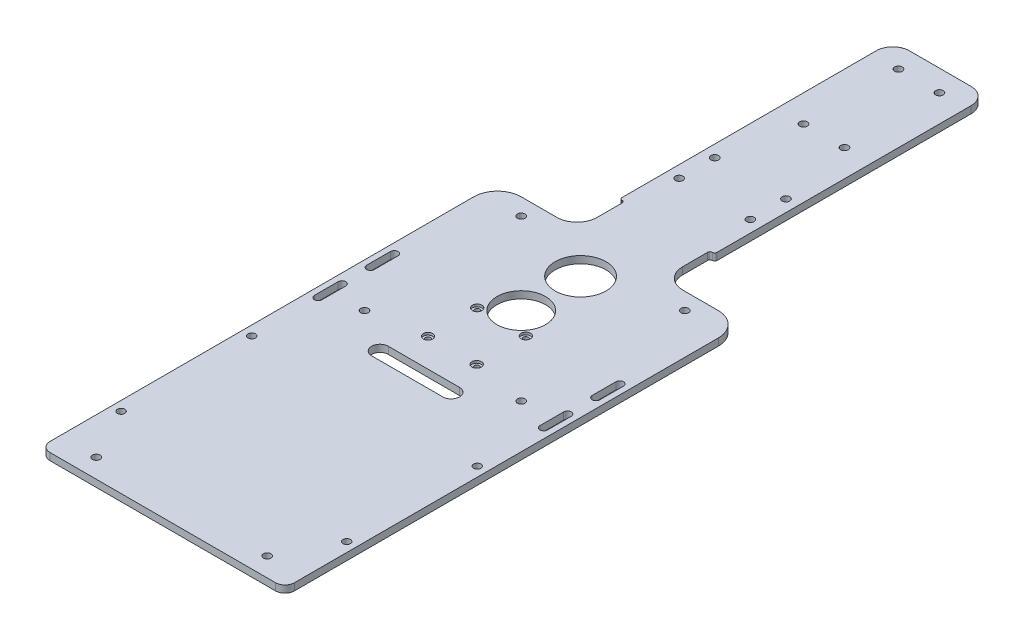
from build123d import *

# Parameters (mm, degrees)
SKETCH_1_W                = 200
SKETCH_1_H                = 200
EXTRUDE_1_DEPTH           = 3
SKETCH_2_R                = 1.5
CUT_EXTRUDE_2_DEPTH       = 10
CUT_EXTRUDE_3_DEPTH       = 10
SKETCH_6_R                = 1.6
CUT_EXTRUDE_3_1_1_DEPTH   = 10
CUT_EXTRUDE_6_REACH       = 111.495
SKETCH_11_R               = 1.5
CUT_EXTRUDE_21_4_REACH    = 111.495
SKETCH_4_R                = 10.7
FILLET_1_R                = 1
SKETCH_12_W               = 40
SKETCH_12_H               = 3
EXTRUDE_2_DEPTH           = 75
FILLET_2_R                = 7
SKETCH_13_R               = 1.6
CUT_EXTRUDE_3_2_3_DEPTH   = 10
SKETCH_19_W               = 89
SKETCH_19_H               = 3
EXTRUDE_3_DEPTH           = 105
CUT_EXTRUDE_7519_REACH    = 211.796
SKETCH_14_R               = 10.25
HOLE_WIZARD_1_D           = 2.2
HOLE_WIZARD_1_CBORE_D     = 4
HOLE_WIZARD_1_CBORE_DEPTH = 1
CUT_EXTRUDE_8_REACH       = 211.796
SKETCH_23_R               = 1.6
SKETCH_24_W               = 192.5
SKETCH_24_H               = 3
EXTRUDE_4_DEPTH           = 7
FILLET_3_R                = 10
CUT_EXTRUDE_10527_DEPTH   = 7
CUT_EXTRUDE_7_REACH       = 213.391
SKETCH_22_R               = 1.6
SKETCH_16_R               = 1.6
CUT_EXTRUDE_9_DEPTH       = 10
CUT_EXTRUDE_13046_DEPTH   = 10
HOLE_WIZARD_3_1_3_1_1_D   = 3.1
FILLET_4_R                = 4


with BuildPart() as part:
    # 草图1 → 凸台-拉伸1 (new body)
    with BuildSketch(Plane(origin=(0, 0, 0), x_dir=(1, 0, 0), z_dir=(0, 1, 0))):
        Rectangle(SKETCH_1_W, SKETCH_1_H)
    extrude(amount=EXTRUDE_1_DEPTH)

    # 草图2 → 切除-拉伸2 (cut)
    with BuildSketch(Plane(origin=(0, 3, 0), x_dir=(1, 0, 0), z_dir=(0, 1, 0))):
        with Locations(Location((29.5, 9.5, 0), (0, 0, 270))):
            Circle(SKETCH_2_R)
        with Locations(Location((21.5, 0, 0), (0, 0, 270))):
            Circle(SKETCH_2_R)
        with Locations(Location((29.5, -9.5, 0), (0, 0, 270))):
            Circle(SKETCH_2_R)
        with Locations(Location((37.5, 0, 0), (0, 0, 270))):
            Circle(SKETCH_2_R)
        with Locations(Location((-29.5, -9.5, 0), (0, 0, 270))):
            Circle(SKETCH_2_R)
        with Locations(Location((-37.5, 0, 0), (0, 0, 270))):
            Circle(SKETCH_2_R)
        with Locations(Location((-21.5, 0, 0), (0, 0, 270))):
            Circle(SKETCH_2_R)
        with Locations(Location((-29.5, 9.5, 0), (0, 0, 270))):
            Circle(SKETCH_2_R)
    extrude(amount=-CUT_EXTRUDE_2_DEPTH, mode=Mode.SUBTRACT)

    # 草图5 → 切除-拉伸3 (cut)
    with BuildSketch(Plane(origin=(0, 3, 0), x_dir=(1, 0, 0), z_dir=(0, 1, 0))):
        with BuildLine():
            Line((-100, -100), (-44.5, -100))
            Line((-44.5, -100), (-44.5, 0))
            ThreePointArc((-44.5, 0), (-40.212142643, 10.5), (-29.8, 14.9969997))
            ThreePointArc((-29.8, 14.9969997), (-22.858571571, 17.9949995), (-20, 24.9949995))
            Line((-20, 24.9949995), (-20, 47.5))
            Line((-20, 47.5), (0, 47.5))
            Line((0, 47.5), (20, 47.5))
            Line((20, 47.5), (20, 24.9949995))
            ThreePointArc((20, 24.9949995), (22.858571571, 17.9949995), (29.8, 14.9969997))
            ThreePointArc((29.8, 14.9969997), (40.212142643, 10.5), (44.5, 0))
            Line((44.5, 0), (44.5, -100))
            Line((44.5, -100), (100, -100))
            Line((100, -100), (100, 100))
            Line((100, 100), (-100, 100))
            Line((-100, 100), (-100, -100))
        make_face()
    extrude(amount=-CUT_EXTRUDE_3_DEPTH, mode=Mode.SUBTRACT)

    # 草图6 → φ3.1通孔1 (cut)
    with BuildSketch(Plane.XZ):
        with Locations(Location((-15, -42.5, 0), (0, 0, 270))):
            Circle(SKETCH_6_R)
        with Locations(Location((-15, -27.5, 0), (0, 0, 270))):
            Circle(SKETCH_6_R)
        with Locations(Location((15, -27.5, 0), (0, 0, 90))):
            Circle(SKETCH_6_R)
        with Locations(Location((15, -42.5, 0), (0, 0, 90))):
            Circle(SKETCH_6_R)
    extrude(amount=-CUT_EXTRUDE_3_1_1_DEPTH, mode=Mode.SUBTRACT)

    # 草图11 → 切除-拉伸6 (cut, up to next)
    with BuildSketch(Plane(origin=(0, 3, 0), x_dir=(1, 0, 0), z_dir=(0, 1, 0)), mode=Mode.PRIVATE) as cut_extrude_6_sk1:
        with BuildLine():
            Line((44.5, -17.5), (44.5, -100))
            Line((44.5, -100), (101.133062566, -100))
            Line((101.133062566, -100), (101.133062566, 47.5))
            Line((101.133062566, 47.5), (20, 47.5))
            Line((20, 47.5), (20, 7.5))
            Line((20, 7.5), (19, 7.5))
            ThreePointArc((19, 7.5), (18.292893219, 7.207106781), (18, 6.5))
            Line((18, 6.5), (18, -4))
            ThreePointArc((18, -4), (20.48959236, -10.01040764), (26.5, -12.5))
            Line((26.5, -12.5), (39.5, -12.5))
            Line((39.5, -12.5), (44.5, -12.5))
            Line((44.5, -12.5), (44.5, -17.5))
        make_face()
        with Locations((29.5, -9.5)):
            Circle(SKETCH_11_R, mode=Mode.SUBTRACT)
        with Locations((21.5, 0)):
            Circle(SKETCH_11_R, mode=Mode.SUBTRACT)
    cut_extrude_6_tool1 = extrude(cut_extrude_6_sk1.sketch, amount=-CUT_EXTRUDE_6_REACH, mode=Mode.PRIVATE) & part.part
    # 草图11 → 切除-拉伸6 (cut, up to next)
    with BuildSketch(Plane(origin=(0, 3, 0), x_dir=(1, 0, 0), z_dir=(0, 1, 0)), mode=Mode.PRIVATE) as cut_extrude_6_sk2:
        with BuildLine():
            Line((-44.5, -17.5), (-44.5, -100))
            Line((-44.5, -100), (-101.133062566, -100))
            Line((-101.133062566, -100), (-101.133062566, 47.5))
            Line((-101.133062566, 47.5), (-20, 47.5))
            Line((-20, 47.5), (-20, 7.5))
            Line((-20, 7.5), (-19, 7.5))
            ThreePointArc((-19, 7.5), (-18.292893219, 7.207106781), (-18, 6.5))
            Line((-18, 6.5), (-18, -4))
            ThreePointArc((-18, -4), (-20.48959236, -10.01040764), (-26.5, -12.5))
            Line((-26.5, -12.5), (-39.5, -12.5))
            Line((-39.5, -12.5), (-44.5, -12.5))
            Line((-44.5, -12.5), (-44.5, -17.5))
        make_face()
    cut_extrude_6_tool2 = extrude(cut_extrude_6_sk2.sketch, amount=-CUT_EXTRUDE_6_REACH, mode=Mode.PRIVATE) & part.part
    add(cut_extrude_6_tool1.solids().sort_by_distance((66.686037, 3, 19.669577))[0], mode=Mode.SUBTRACT)
    add(cut_extrude_6_tool2.solids().sort_by_distance((-66.626911, 3, 19.648158))[0], mode=Mode.SUBTRACT)

    # 草图4 → φ21.4落弹孔 (cut, up to next)
    with BuildSketch(Plane(origin=(0, 3, 0), x_dir=(1, 0, 0), z_dir=(0, 1, 0)), mode=Mode.PRIVATE) as cut_extrude_21_4_sk1:
        with Locations(Location((0, -29, 0), (0, 0, 270))):
            Circle(SKETCH_4_R)
    cut_extrude_21_4_tool1 = extrude(cut_extrude_21_4_sk1.sketch, amount=-CUT_EXTRUDE_21_4_REACH, mode=Mode.PRIVATE) & part.part
    add(cut_extrude_21_4_tool1.solids().sort_by_distance((0, 3, 29))[0], mode=Mode.SUBTRACT)

    # 圆角1
    fillet_1_edges = [part.edges().sort_by_distance(p)[0] for p in [
        (-20, 1.5, -7.5),
        (20, 1.5, -7.5),
    ]]
    fillet(fillet_1_edges, radius=FILLET_1_R - 0.0001)  # a hair under: the kernel refuses the full size

    # 草图12 → 凸台-拉伸2 (add)
    with BuildSketch(Plane(origin=(0, 0, -47.5), x_dir=(-1, 0, 0), z_dir=(0, 0, -1))):
        with Locations((0, 1.5)):
            Rectangle(SKETCH_12_W, SKETCH_12_H)
    extrude(amount=EXTRUDE_2_DEPTH)

    # 圆角2
    fillet_2_edges = [part.edges().sort_by_distance(p)[0] for p in [
        (20, 1.5, -122.5),
        (-20, 1.5, -122.5),
    ]]
    fillet(fillet_2_edges, radius=FILLET_2_R)

    # 草图13 → φ3.2通孔3 (cut)
    with BuildSketch(Plane(origin=(0, 3, 0), x_dir=(1, 0, 0), z_dir=(0, 1, 0))):
        with Locations(Location((-8.625, 113.5, 0), (0, 0, 270))):
            Circle(SKETCH_13_R)
        with Locations(Location((8.625, 113.5, 0), (0, 0, 270))):
            Circle(SKETCH_13_R)
        with Locations(Location((8.625, 73.5, 0), (0, 0, 270))):
            Circle(SKETCH_13_R)
        with Locations(Location((-8.625, 73.5, 0), (0, 0, 270))):
            Circle(SKETCH_13_R)
    extrude(amount=-CUT_EXTRUDE_3_2_3_DEPTH, mode=Mode.SUBTRACT)

    # 草图19 → 凸台-拉伸3 (add)
    with BuildSketch(Plane.XY.offset(100)):
        with Locations((0, 1.5)):
            Rectangle(SKETCH_19_W, SKETCH_19_H)
    extrude(amount=EXTRUDE_3_DEPTH)

    # 草图14 → Cut-Extrude 7519 (cut, up to next)
    with BuildSketch(Plane(origin=(0, 3, 0), x_dir=(1, 0, 0), z_dir=(0, 1, 0)), mode=Mode.PRIVATE) as cut_extrude_7519_sk1:
        with Locations(Location((0, -54, 0), (0, 0, 270))):
            Circle(SKETCH_14_R)
    cut_extrude_7519_tool1 = extrude(cut_extrude_7519_sk1.sketch, amount=-CUT_EXTRUDE_7519_REACH, mode=Mode.PRIVATE) & part.part
    add(cut_extrude_7519_tool1.solids().sort_by_distance((0, 3, 54))[0], mode=Mode.SUBTRACT)

    # 孔1 (through all)
    with Locations(Plane(origin=(-10.25, 3, 62.3), x_dir=(0, 0, 1), z_dir=(0, 1, 0))):
        with Locations((0, 0), (0, 20.5), (20.7, 0), (20.7, 20.5)):
            CounterBoreHole(HOLE_WIZARD_1_D / 2, HOLE_WIZARD_1_CBORE_D / 2, HOLE_WIZARD_1_CBORE_DEPTH)

    # 草图23 → 切除-拉伸8 (cut, up to next)
    with BuildSketch(Plane(origin=(0, 3, 0), x_dir=(1, 0, 0), z_dir=(0, 1, 0)), mode=Mode.PRIVATE) as cut_extrude_8_sk1:
        with Locations(Location((33, -87, 0), (0, 0, 270))):
            Circle(SKETCH_23_R)
    cut_extrude_8_tool1 = extrude(cut_extrude_8_sk1.sketch, amount=-CUT_EXTRUDE_8_REACH, mode=Mode.PRIVATE) & part.part
    # 草图23 → 切除-拉伸8 (cut, up to next)
    with BuildSketch(Plane(origin=(0, 3, 0), x_dir=(1, 0, 0), z_dir=(0, 1, 0)), mode=Mode.PRIVATE) as cut_extrude_8_sk2:
        with Locations(Location((-33, -87, 0), (0, 0, 270))):
            Circle(SKETCH_23_R)
    cut_extrude_8_tool2 = extrude(cut_extrude_8_sk2.sketch, amount=-CUT_EXTRUDE_8_REACH, mode=Mode.PRIVATE) & part.part
    add(cut_extrude_8_tool1.solids().sort_by_distance((33, 3, 87))[0], mode=Mode.SUBTRACT)
    add(cut_extrude_8_tool2.solids().sort_by_distance((-33, 3, 87))[0], mode=Mode.SUBTRACT)

    # 草图24 → 凸台-拉伸4 (add)
    with BuildSketch(Plane.ZY.offset(44.5)):
        with Locations((108.75, 1.5)):
            Rectangle(SKETCH_24_W, SKETCH_24_H)
    extrude_4 = extrude(amount=EXTRUDE_4_DEPTH)

    # 镜向2: 凸台-拉伸4 across plane
    add(extrude_4.mirror(Plane(origin=(0, 0, 0), x_dir=(0, 0, 1), z_dir=(1, 0, 0))))

    # 圆角3
    fillet_3_edges = [part.edges().sort_by_distance(p)[0] for p in [
        (-51.5, 1.5, 12.5),
        (51.5, 1.5, 12.5),
    ]]
    fillet(fillet_3_edges, radius=FILLET_3_R)

    # 草图17 → Cut-Extrude 10527 (cut)
    with BuildSketch(Plane(origin=(0, 3, 0), x_dir=(1, 0, 0), z_dir=(0, 1, 0))):
        with BuildLine():
            Line((-49.1, -70), (-49.1, -60))
            ThreePointArc((-49.1, -60), (-47.5, -58.4), (-45.9, -60))
            Line((-45.9, -60), (-45.9, -70))
            ThreePointArc((-45.9, -70), (-47.5, -71.6), (-49.1, -70))
        make_face()
        with BuildLine():
            Line((-49.1, -92), (-49.1, -82))
            ThreePointArc((-49.1, -82), (-47.5, -80.4), (-45.9, -82))
            Line((-45.9, -82), (-45.9, -92))
            ThreePointArc((-45.9, -92), (-47.5, -93.6), (-49.1, -92))
        make_face()
        with BuildLine():
            Line((45.9, -92), (45.9, -82))
            ThreePointArc((45.9, -82), (47.5, -80.4), (49.1, -82))
            Line((49.1, -82), (49.1, -92))
            ThreePointArc((49.1, -92), (47.5, -93.6), (45.9, -92))
        make_face()
        with BuildLine():
            Line((45.9, -70), (45.9, -60))
            ThreePointArc((45.9, -60), (47.5, -58.4), (49.1, -60))
            Line((49.1, -60), (49.1, -70))
            ThreePointArc((49.1, -70), (47.5, -71.6), (45.9, -70))
        make_face()
    extrude(amount=-CUT_EXTRUDE_10527_DEPTH, mode=Mode.SUBTRACT)

    # 草图22 → 切除-拉伸7 (cut, up to next)
    with BuildSketch(Plane(origin=(0, 3, 0), x_dir=(1, 0, 0), z_dir=(0, 1, 0)), mode=Mode.PRIVATE) as cut_extrude_7_sk1:
        with Locations(Location((-36, -197, 0), (0, 0, 270))):
            Circle(SKETCH_22_R)
    cut_extrude_7_tool1 = extrude(cut_extrude_7_sk1.sketch, amount=-CUT_EXTRUDE_7_REACH, mode=Mode.PRIVATE) & part.part
    # 草图22 → 切除-拉伸7 (cut, up to next)
    with BuildSketch(Plane(origin=(0, 3, 0), x_dir=(1, 0, 0), z_dir=(0, 1, 0)), mode=Mode.PRIVATE) as cut_extrude_7_sk2:
        with Locations(Location((36, -197, 0), (0, 0, 270))):
            Circle(SKETCH_22_R)
    cut_extrude_7_tool2 = extrude(cut_extrude_7_sk2.sketch, amount=-CUT_EXTRUDE_7_REACH, mode=Mode.PRIVATE) & part.part
    add(cut_extrude_7_tool1.solids().sort_by_distance((-36, 3, 197))[0], mode=Mode.SUBTRACT)
    add(cut_extrude_7_tool2.solids().sort_by_distance((36, 3, 197))[0], mode=Mode.SUBTRACT)

    # 草图16 → 切除-拉伸9 (cut)
    with BuildSketch(Plane(origin=(0, 3, 0), x_dir=(1, 0, 0), z_dir=(0, 1, 0))):
        with Locations(Location((-34.446696938, -19.553303062, 0), (0, 0, 270))):
            Circle(SKETCH_16_R)
        with Locations(Location((34.446696938, -19.553303062, 0), (0, 0, 270))):
            Circle(SKETCH_16_R)
    extrude(amount=-CUT_EXTRUDE_9_DEPTH, mode=Mode.SUBTRACT)

    # 草图25 → Cut-Extrude 13046 (cut)
    with BuildSketch(Plane(origin=(0, 3, 0), x_dir=(1, 0, 0), z_dir=(0, 1, 0))):
        with BuildLine():
            Line((-15, -95), (15, -95))
            ThreePointArc((15, -95), (18.5, -98.5), (15, -102))
            Line((15, -102), (-15, -102))
            ThreePointArc((-15, -102), (-18.5, -98.5), (-15, -95))
        make_face()
    extrude(amount=-CUT_EXTRUDE_13046_DEPTH, mode=Mode.SUBTRACT)

    # Ø3.1 (3.1) 直径孔1 (through all)
    with Locations(Plane(origin=(-47.5, 3, 120), x_dir=(0, 0, 1), z_dir=(0, 1, 0))):
        with Locations((0, 0), (0, 95), (55, 95), (55, 0)):
            Hole(HOLE_WIZARD_3_1_3_1_1_D / 2)

    # 圆角4
    fillet_4_edges = [part.edges().sort_by_distance(p)[0] for p in [
        (-51.5, 1.5, 205),
        (51.5, 1.5, 205),
    ]]
    fillet(fillet_4_edges, radius=FILLET_4_R)


solid = part.part
